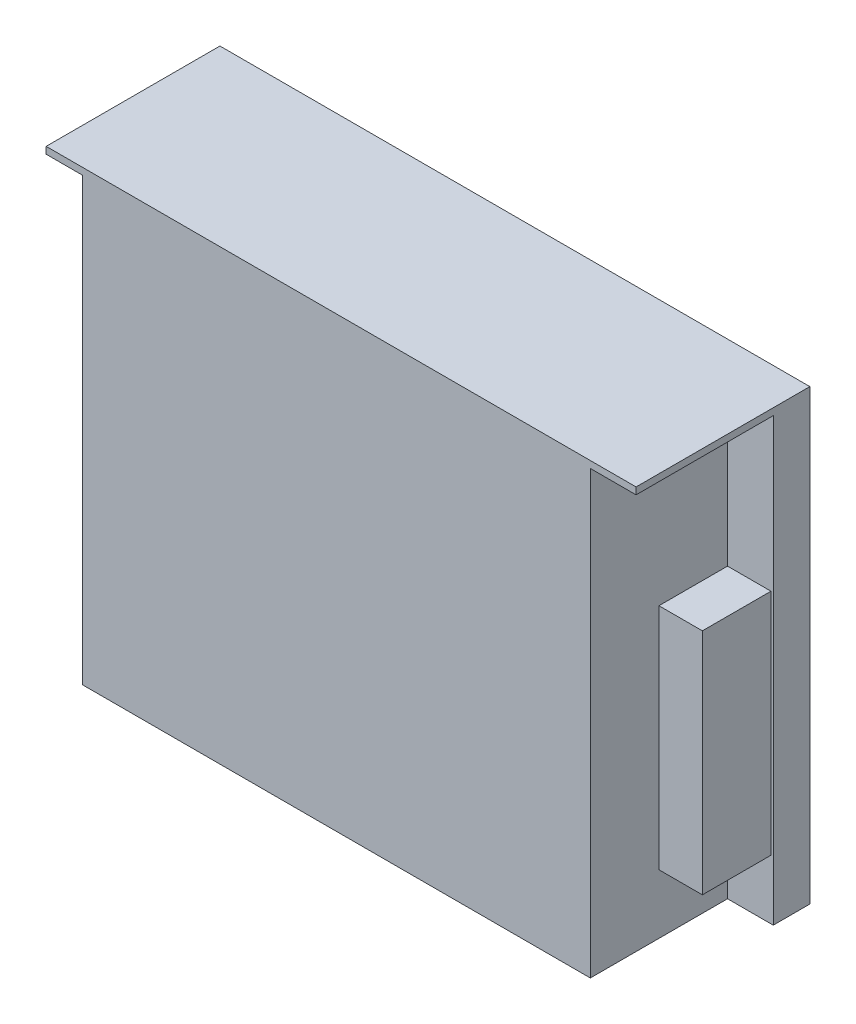
from build123d import *

# Parameters (mm, degrees)
SKETCH_1_W          = 129
SKETCH_1_H          = 98
EXTRUDE_1_DEPTH     = 38
SKETCH_2_W          = 10
SKETCH_2_H          = 96.5
CUT_EXTRUDE_1_DEPTH = 30
SKETCH_3_W          = 9.5
SKETCH_3_H          = 50
EXTRUDE_2_DEPTH     = 15
SKETCH_4_W          = 29
SKETCH_4_H          = 96.5
CUT_EXTRUDE_2_DEPTH = 8
CHAMFER_1_SIZE      = 8
CUT_EXTRUDE_3_DEPTH = 10


with BuildPart() as part:
    # 草图1 → 凸台-拉伸1 (new body)
    with BuildSketch(Plane.XY):
        with Locations((64.5, 49)):
            Rectangle(SKETCH_1_W, SKETCH_1_H)
    extrude(amount=EXTRUDE_1_DEPTH)

    # 草图2 → 切除-拉伸1 (cut)
    with BuildSketch(Plane.XY.offset(38)):
        with Locations((124, 48.25)):
            Rectangle(SKETCH_2_W, SKETCH_2_H)
    extrude(amount=-CUT_EXTRUDE_1_DEPTH, mode=Mode.SUBTRACT)

    # 草图3 → 凸台-拉伸2 (add)
    with BuildSketch(Plane.XY.offset(8)):
        with Locations((123.75, 38)):
            Rectangle(SKETCH_3_W, SKETCH_3_H)
    extrude(amount=EXTRUDE_2_DEPTH)

    # 草图4 → 切除-拉伸2 (cut)
    with BuildSketch(Plane.ZY):
        with Locations((23.5, 48.25)):
            Rectangle(SKETCH_4_W, SKETCH_4_H)
    extrude(amount=-CUT_EXTRUDE_2_DEPTH, mode=Mode.SUBTRACT)

    # 倒角1
    chamfer_1_edges = [part.edges().sort_by_distance(p)[0] for p in [
        (8, 48.25, 9),
    ]]
    chamfer(chamfer_1_edges, length=CHAMFER_1_SIZE - 0.0001)  # a hair under: the kernel refuses the full size

    # 草图5 → 切除-拉伸3 (cut)
    with BuildSketch(Plane.XZ):
        Polygon((0, 9), (8, 17), (8, 1.5), (0, 1.5), align=None)
    extrude(amount=-CUT_EXTRUDE_3_DEPTH, mode=Mode.SUBTRACT)


solid = part.part
